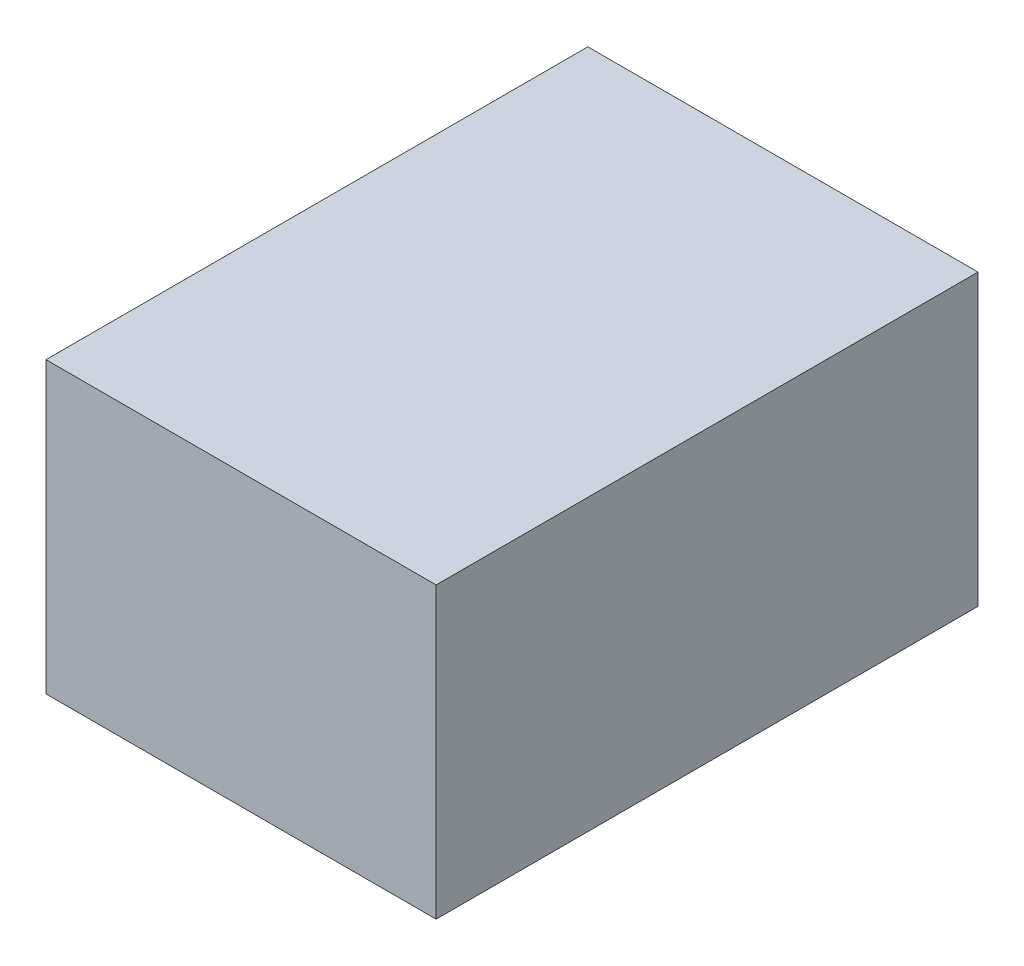
from build123d import *

# Parameters (mm, degrees)
BOSS_EXTRUDE1_DEPTH      = 23.749
BOSS_EXTRUDE1_DEPTH_BACK = 23.749
SKETCH1_W                = 64.008
SKETCH1_H                = 88.9


with BuildPart() as part:
    # Sketch1 → Boss-Extrude1 (new, two sides: drawn at the far end of the back side and taken through both)
    with BuildSketch(Plane(origin=(0, 0, 0), x_dir=(1, 0, 0), z_dir=(0, 1, 0)).offset(-BOSS_EXTRUDE1_DEPTH_BACK)):
        Rectangle(SKETCH1_W, SKETCH1_H)
    extrude(amount=BOSS_EXTRUDE1_DEPTH + BOSS_EXTRUDE1_DEPTH_BACK)


solid = part.part
